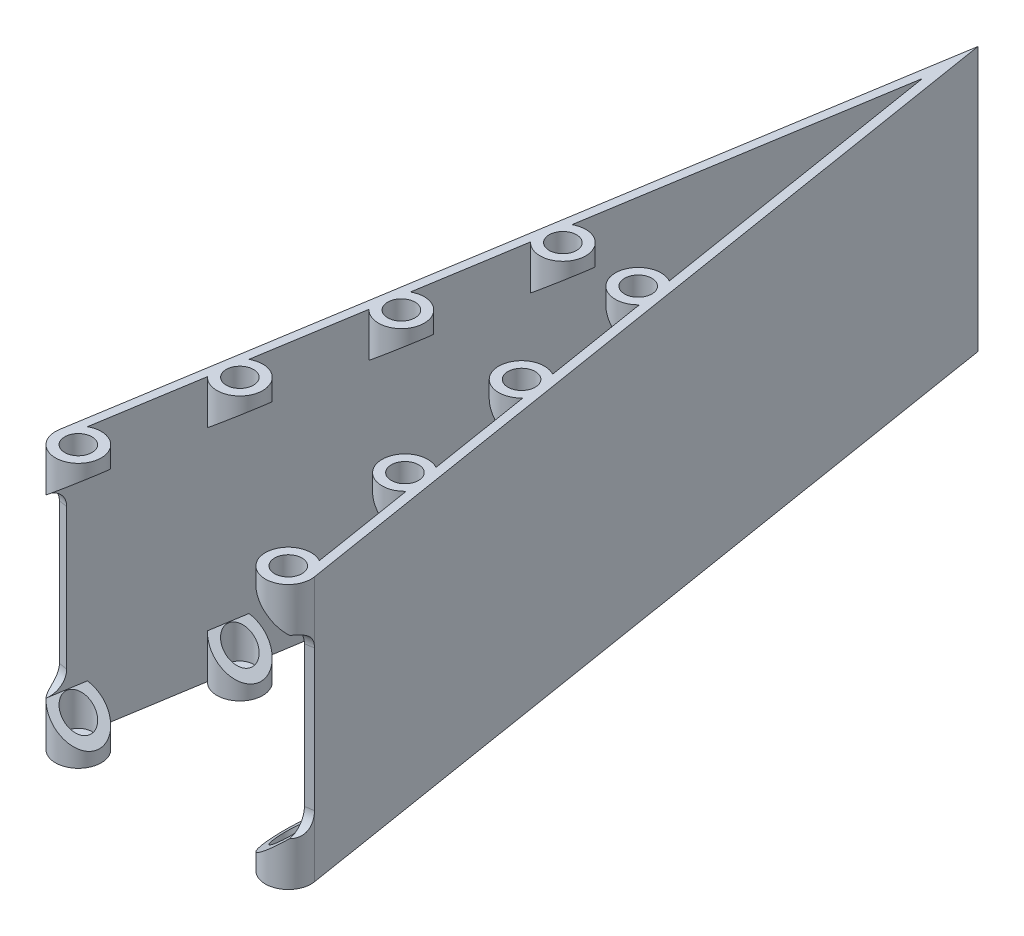
from build123d import *

# Parameters (mm, degrees)
BOSS_EXTRUDE1_DEPTH            = 30
SKETCH2_R                      = 2.6
SKETCH2_R_2                    = 1.55
BOSS_EXTRUDE3_DEPTH            = 5
CUT_EXTRUDE1_REACH             = 100.017
CUT_EXTRUDE1_DIRECTION_2_DEPTH = 99.016911981
CUT_EXTRUDE2_REACH             = 100.017
CUT_EXTRUDE2_DIRECTION_2_DEPTH = 99.016911981
FILLET1_R                      = 2
SKETCH6_R                      = 2.6
BOSS_EXTRUDE4_DEPTH            = 1


with BuildPart() as part:
    # Sketch1 → Boss-Extrude1 (new body)
    with BuildSketch(Plane(origin=(0, 0, 0), x_dir=(1, 0, 0), z_dir=(0, 1, 0))):
        Polygon((-13.5, 0), (0, 83.718518379), (13.5, 0), (14.487246657, 0.15919811), (0, 90), (-14.487246657, 0.15919811), align=None)
    extrude(amount=BOSS_EXTRUDE1_DEPTH)

    # Sketch2 → Boss-Extrude3 (add)
    # profile 1 of 8: a face of its own
    with BuildSketch(Plane(origin=(0, 0, 0), x_dir=(1, 0, 0), z_dir=(0, 1, 0))):
        with Locations((11.920405349, -0.254716975)):
            Circle(SKETCH2_R)
        with Locations(Location((11.920405349, -0.254716975, 0), (0, 0, 270))):
            Circle(SKETCH2_R_2, mode=Mode.SUBTRACT)
    # profile 2 of 8: a face of its own
    with BuildSketch(Plane(origin=(0, 0, 0), x_dir=(1, 0, 0), z_dir=(0, 1, 0))):
        with Locations((9.373235594, 15.541229537)):
            Circle(SKETCH2_R)
        with Locations(Location((9.373235594, 15.541229537, 0), (0, 0, 270))):
            Circle(SKETCH2_R_2, mode=Mode.SUBTRACT)
    # profile 3 of 8: a face of its own
    with BuildSketch(Plane(origin=(0, 0, 0), x_dir=(1, 0, 0), z_dir=(0, 1, 0))):
        with Locations((6.826065839, 31.33717605)):
            Circle(SKETCH2_R)
        with Locations(Location((6.826065839, 31.33717605, 0), (0, 0, 270))):
            Circle(SKETCH2_R_2, mode=Mode.SUBTRACT)
    # profile 4 of 8: a face of its own
    with BuildSketch(Plane(origin=(0, 0, 0), x_dir=(1, 0, 0), z_dir=(0, 1, 0))):
        with Locations((4.278896085, 47.133122563)):
            Circle(SKETCH2_R)
        with Locations(Location((4.278896085, 47.133122563, 0), (0, 0, 270))):
            Circle(SKETCH2_R_2, mode=Mode.SUBTRACT)
    # profile 5 of 8: a face of its own
    with BuildSketch(Plane(origin=(0, 0, 0), x_dir=(1, 0, 0), z_dir=(0, 1, 0))):
        with Locations((-4.278896085, 47.133122563)):
            Circle(SKETCH2_R)
        with Locations(Location((-4.278896085, 47.133122563, 0), (0, 0, 90))):
            Circle(SKETCH2_R_2, mode=Mode.SUBTRACT)
    # profile 6 of 8: a face of its own
    with BuildSketch(Plane(origin=(0, 0, 0), x_dir=(1, 0, 0), z_dir=(0, 1, 0))):
        with Locations((-6.826065839, 31.33717605)):
            Circle(SKETCH2_R)
        with Locations(Location((-6.826065839, 31.33717605, 0), (0, 0, 90))):
            Circle(SKETCH2_R_2, mode=Mode.SUBTRACT)
    # profile 7 of 8: a face of its own
    with BuildSketch(Plane(origin=(0, 0, 0), x_dir=(1, 0, 0), z_dir=(0, 1, 0))):
        with Locations((-9.373235594, 15.541229537)):
            Circle(SKETCH2_R)
        with Locations(Location((-9.373235594, 15.541229537, 0), (0, 0, 90))):
            Circle(SKETCH2_R_2, mode=Mode.SUBTRACT)
    # profile 8 of 8: a face of its own
    with BuildSketch(Plane(origin=(0, 0, 0), x_dir=(1, 0, 0), z_dir=(0, 1, 0))):
        with Locations((-11.920405349, -0.254716975)):
            Circle(SKETCH2_R)
        with Locations(Location((-11.920405349, -0.254716975, 0), (0, 0, 90))):
            Circle(SKETCH2_R_2, mode=Mode.SUBTRACT)
    boss_extrude3 = extrude(amount=BOSS_EXTRUDE3_DEPTH)

    # Cut-Extrude1: up to this face of the body (flat: up to its plane)
    cut_extrude1_end = Plane(part.part.faces().sort_by_distance((-6.68152525, 15.362665762, -42.28389657))[0])
    # Sketch4 → Cut-Extrude1 (cut, up to the picked face)
    with BuildSketch(Plane(origin=(0.342144515, 0, 2.121765321), x_dir=(0.9872466570606503, 0, -0.1591981096702188), z_dir=(0.1591981096702188, 0, 0.9872466570606503)), mode=Mode.PRIVATE) as cut_extrude1_sk1:
        Polygon((13.32782987, 5), (9.12782987, 5), (9.12782987, 1.475781549), align=None)
    cut_extrude1_tool1 = split(extrude(cut_extrude1_sk1.sketch, amount=-CUT_EXTRUDE1_REACH, mode=Mode.PRIVATE), bisect_by=cut_extrude1_end, keep=Keep.BOTH, mode=Mode.PRIVATE)
    cut_extrude1 = cut_extrude1_tool1.solids().sort_by(Axis((10.735709, 3.825261, 0.445755), (-0.1591981096702188, 0, -0.9872466570606503)))[0]
    add(cut_extrude1, mode=Mode.SUBTRACT)

    # Sketch4 → Cut-Extrude1 direction 2 (cut)
    with BuildSketch(Plane(origin=(0.342144515, 0, 2.121765321), x_dir=(0.9872466570606503, 0, -0.1591981096702188), z_dir=(0.1591981096702188, 0, 0.9872466570606503))):
        Polygon((13.32782987, 5), (9.12782987, 5), (9.12782987, 1.475781549), align=None)
    cut_extrude1_direction_2 = extrude(amount=CUT_EXTRUDE1_DIRECTION_2_DEPTH, mode=Mode.SUBTRACT)

    # Cut-Extrude2: up to this face of the body (flat: up to its plane)
    cut_extrude2_end = Plane(part.part.faces().sort_by_distance((6.68152525, 15.362665762, -42.28389657))[0])
    # Sketch5 → Cut-Extrude2 (cut, up to the picked face)
    with BuildSketch(Plane(origin=(-0.342144515, 0, 2.121765321), x_dir=(0.9872466570606502, 0, 0.15919810967021986), z_dir=(-0.15919810967021986, 0, 0.9872466570606502)), mode=Mode.PRIVATE) as cut_extrude2_sk1:
        Polygon((-9.12782987, 5), (-9.12782987, 1.475781549), (-13.32782987, 5), align=None)
    cut_extrude2_tool1 = split(extrude(cut_extrude2_sk1.sketch, amount=-CUT_EXTRUDE2_REACH, mode=Mode.PRIVATE), bisect_by=cut_extrude2_end, keep=Keep.BOTH, mode=Mode.PRIVATE)
    cut_extrude2 = cut_extrude2_tool1.solids().sort_by(Axis((-10.735709, 3.825261, 0.445755), (0.15919810967021986, 0, -0.9872466570606502)))[0]
    add(cut_extrude2, mode=Mode.SUBTRACT)

    # Sketch5 → Cut-Extrude2 direction 2 (cut)
    with BuildSketch(Plane(origin=(-0.342144515, 0, 2.121765321), x_dir=(0.9872466570606502, 0, 0.15919810967021986), z_dir=(-0.15919810967021986, 0, 0.9872466570606502))):
        Polygon((-9.12782987, 5), (-9.12782987, 1.475781549), (-13.32782987, 5), align=None)
    cut_extrude2_direction_2 = extrude(amount=CUT_EXTRUDE2_DIRECTION_2_DEPTH, mode=Mode.SUBTRACT)

    # Mirror2: Boss-Extrude3, Cut-Extrude1, Cut-Extrude1 direction 2, Cut-Extrude2, Cut-Extrude2 direction 2 across plane
    add(boss_extrude3.mirror(Plane.ZX.offset(15)))
    add(cut_extrude1.mirror(Plane.ZX.offset(15)), mode=Mode.SUBTRACT)
    add(cut_extrude1_direction_2.mirror(Plane.ZX.offset(15)), mode=Mode.SUBTRACT)
    add(cut_extrude2.mirror(Plane.ZX.offset(15)), mode=Mode.SUBTRACT)
    add(cut_extrude2_direction_2.mirror(Plane.ZX.offset(15)), mode=Mode.SUBTRACT)

    # Fillet1
    # the kernel refuses this fillet: 2 mm, written as the material it adds along each edge
    with BuildSketch(Plane(origin=(-19.423479942, 5, -0.955188658), x_dir=(-0.15919810967021975, 0, 0.9872466570606501), z_dir=(0.9872466570606501, 0, 0.15919810967021975))) as fillet1_piece_1_section:
        with BuildLine():
            CenterArc((FILLET1_R, -FILLET1_R), FILLET1_R, 90, 90)
            Line((0, -FILLET1_R), (0, 0))
            Line((0, 0), (FILLET1_R, 0))
        make_face()
    fillet1_piece_1 = extrude(amount=6, mode=Mode.PRIVATE)
    fillet1_piece_1 = fillet1_piece_1 & Plane(origin=(-11.920405349, 5.222362792, 0.254716975), x_dir=(1, 0, 0), z_dir=(0, -1, 0)) * Cylinder(2.6, 21, mode=Mode.PRIVATE)
    add(fillet1_piece_1)
    with BuildSketch(Plane(origin=(13.5, 5, 0), x_dir=(0, 1, 0), z_dir=(0.9872466570606502, 0, -0.15919810967021866))) as fillet1_piece_2_section:
        with BuildLine():
            CenterArc((FILLET1_R, FILLET1_R), FILLET1_R, 180, 90)
            Line((0, FILLET1_R), (0, 0))
            Line((0, 0), (FILLET1_R, 0))
        make_face()
    fillet1_piece_2 = extrude(amount=6, mode=Mode.PRIVATE)
    fillet1_piece_2 = fillet1_piece_2 & Plane(origin=(11.920405349, 5.699977741, 0.254716975), x_dir=(1, 0, 0), z_dir=(0, -1, 0)) * Cylinder(2.6, 20, mode=Mode.PRIVATE)
    add(fillet1_piece_2)
    with BuildSketch(Plane(origin=(13.5, 25, 0), x_dir=(0, -1, 0), z_dir=(0.9872466570606502, 0, -0.15919810967021866))) as fillet1_piece_3_section:
        with BuildLine():
            CenterArc((FILLET1_R, -FILLET1_R), FILLET1_R, 90, 90)
            Line((0, -FILLET1_R), (0, 0))
            Line((0, 0), (FILLET1_R, 0))
        make_face()
    fillet1_piece_3 = extrude(amount=6, mode=Mode.PRIVATE)
    fillet1_piece_3 = fillet1_piece_3 & Plane(origin=(11.920405349, 24.300022259, 0.254716975), x_dir=(1, 0, 0), z_dir=(0, 1, 0)) * Cylinder(2.6, 20, mode=Mode.PRIVATE)
    add(fillet1_piece_3)
    with BuildSketch(Plane(origin=(-19.423479942, 25, -0.955188658), x_dir=(0, -1, 0), z_dir=(0.9872466570606501, 0, 0.15919810967021975))) as fillet1_piece_4_section:
        with BuildLine():
            CenterArc((FILLET1_R, -FILLET1_R), FILLET1_R, 90, 90)
            Line((0, -FILLET1_R), (0, 0))
            Line((0, 0), (FILLET1_R, 0))
        make_face()
    fillet1_piece_4 = extrude(amount=6, mode=Mode.PRIVATE)
    fillet1_piece_4 = fillet1_piece_4 & Plane(origin=(-11.920405349, 24.777637105, 0.254716975), x_dir=(1, 0, 0), z_dir=(0, 1, 0)) * Cylinder(2.6, 21, mode=Mode.PRIVATE)
    add(fillet1_piece_4)

    # Sketch6 → Boss-Extrude4 (add)
    with BuildSketch(Plane.XZ):
        with Locations((11.920405349, 0.254716975)):
            Circle(SKETCH6_R)
        with Locations((9.373235594, -15.541229537)):
            Circle(SKETCH6_R)
        with Locations((6.826065839, -31.33717605)):
            Circle(SKETCH6_R)
        with Locations((4.278896085, -47.133122563)):
            Circle(SKETCH6_R)
        with Locations((-4.278896085, -47.133122563)):
            Circle(SKETCH6_R)
        with Locations((-6.826065839, -31.33717605)):
            Circle(SKETCH6_R)
        with Locations((-9.373235594, -15.541229537)):
            Circle(SKETCH6_R)
        with Locations((-11.920405349, 0.254716975)):
            Circle(SKETCH6_R)
    extrude(amount=-BOSS_EXTRUDE4_DEPTH)


solid = part.part
